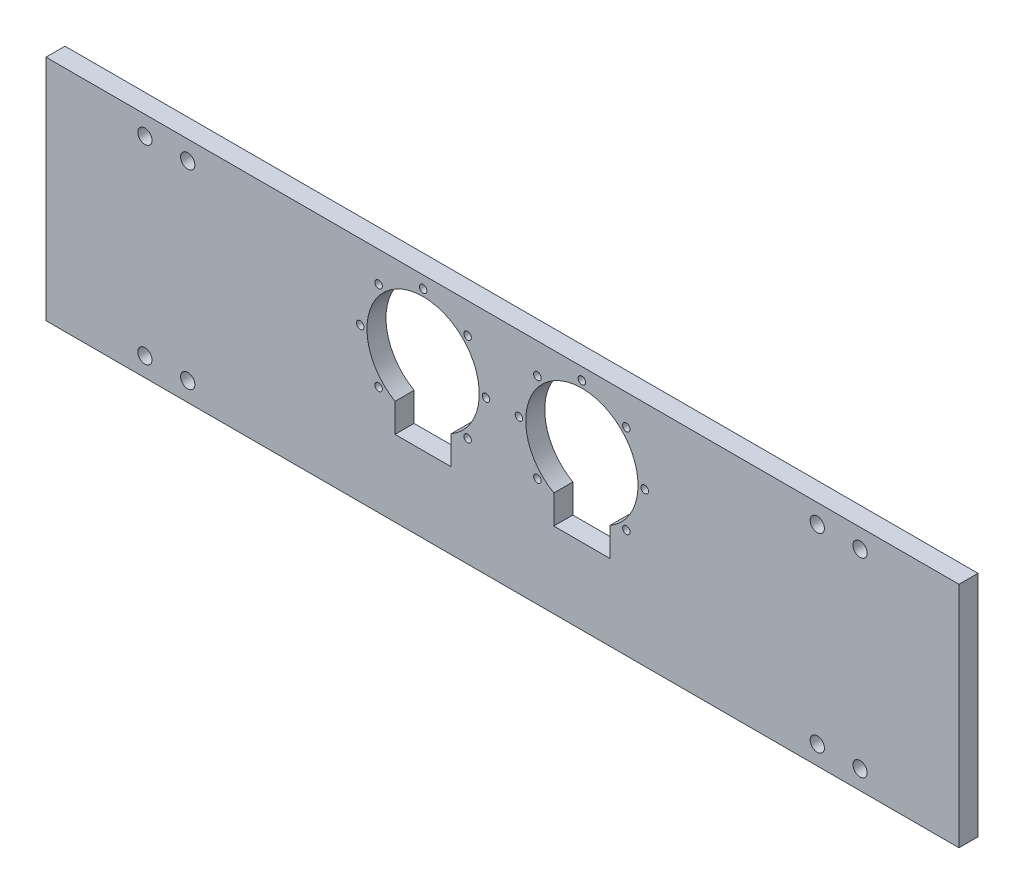
from build123d import *

# Parameters (mm, degrees)
SKETCH1_W           = 609.6
SKETCH1_H           = 152.4
SKETCH1_R           = 2.5
SKETCH1_R_2         = 4.7625
BOSS_EXTRUDE1_DEPTH = 12.7


with BuildPart() as part:
    # Sketch1 → Boss-Extrude1 (new body)
    with BuildSketch(Plane.XY):
        Rectangle(SKETCH1_W, SKETCH1_H)
        with Locations((53, 68.1999984)):
            Circle(SKETCH1_R, mode=Mode.SUBTRACT)
        with Locations((82.698486542, 55.898482492)):
            Circle(SKETCH1_R, mode=Mode.SUBTRACT)
        with Locations((95.00000245, 26.19999595)):
            Circle(SKETCH1_R, mode=Mode.SUBTRACT)
        with Locations((82.698486542, -3.498490592)):
            Circle(SKETCH1_R, mode=Mode.SUBTRACT)
        with Locations((23.301513458, -3.498490592)):
            Circle(SKETCH1_R, mode=Mode.SUBTRACT)
        with Locations((10.99999755, 26.19999595)):
            Circle(SKETCH1_R, mode=Mode.SUBTRACT)
        with Locations((23.301513458, 55.898482492)):
            Circle(SKETCH1_R, mode=Mode.SUBTRACT)
        with Locations((238.76, 63.5)):
            Circle(SKETCH1_R_2, mode=Mode.SUBTRACT)
        with Locations((210.185, 63.5)):
            Circle(SKETCH1_R_2, mode=Mode.SUBTRACT)
        with Locations((238.76, -63.5)):
            Circle(SKETCH1_R_2, mode=Mode.SUBTRACT)
        with Locations((210.185, -63.5)):
            Circle(SKETCH1_R_2, mode=Mode.SUBTRACT)
        with Locations((-82.698486542, -3.498490592)):
            Circle(SKETCH1_R, mode=Mode.SUBTRACT)
        with Locations((-95.00000245, 26.19999595)):
            Circle(SKETCH1_R, mode=Mode.SUBTRACT)
        with Locations((-82.698486542, 55.898482492)):
            Circle(SKETCH1_R, mode=Mode.SUBTRACT)
        with Locations((-53, 68.1999984)):
            Circle(SKETCH1_R, mode=Mode.SUBTRACT)
        with Locations((-23.301513458, 55.898482492)):
            Circle(SKETCH1_R, mode=Mode.SUBTRACT)
        with Locations((-10.99999755, 26.19999595)):
            Circle(SKETCH1_R, mode=Mode.SUBTRACT)
        with Locations((-23.301513458, -3.498490592)):
            Circle(SKETCH1_R, mode=Mode.SUBTRACT)
        with Locations((-238.76, 63.5)):
            Circle(SKETCH1_R_2, mode=Mode.SUBTRACT)
        with Locations((-210.185, 63.5)):
            Circle(SKETCH1_R_2, mode=Mode.SUBTRACT)
        with Locations((-210.185, -63.5)):
            Circle(SKETCH1_R_2, mode=Mode.SUBTRACT)
        with Locations((-238.76, -63.5)):
            Circle(SKETCH1_R_2, mode=Mode.SUBTRACT)
        with BuildLine():
            Line((34.25, -6.275954242), (34.25, -25.4))
            Line((34.25, -25.4), (71.75, -25.4))
            Line((71.75, -25.4), (71.75, -6.275954242))
            ThreePointArc((71.75, -6.275954242), (53, 63.6999984), (34.25, -6.275954242))
        make_face(mode=Mode.SUBTRACT)
        with BuildLine():
            Line((-34.25, -6.275954242), (-34.25, -25.4))
            Line((-34.25, -25.4), (-71.75, -25.4))
            Line((-71.75, -25.4), (-71.75, -6.275954242))
            ThreePointArc((-71.75, -6.275954242), (-53, 63.6999984), (-34.25, -6.275954242))
        make_face(mode=Mode.SUBTRACT)
    extrude(amount=BOSS_EXTRUDE1_DEPTH)


solid = part.part
